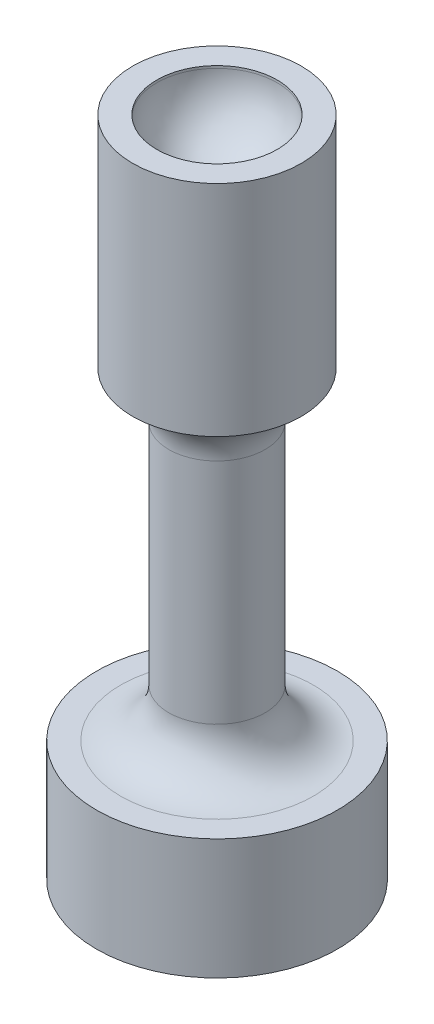
from build123d import *

# Parameters (mm, degrees)
SKETCH1_R           = 5
BOSS_EXTRUDE1_DEPTH = 27.5
SKETCH11_R          = 2.5
CUT_EXTRUDE3_DEPTH  = 0.1
DOME2_FACE_RADIUS   = 2.5
DOME2_HEIGHT        = 2.5
CUT_EXTRUDE4_START  = -22.5
SKETCH12_R          = 5
SKETCH12_R_2        = 3.5
CUT_EXTRUDE4_DEPTH  = 22.5
CUT_EXTRUDE5_DEPTH  = 3
SKETCH14_W          = 3
SKETCH14_H          = 13.4
FILLET2_R           = 2
FILLET3_R           = 2


with BuildPart() as part:
    # Sketch1 → Boss-Extrude1 (new body)
    with BuildSketch(Plane(origin=(0, 0, 0), x_dir=(1, 0, 0), z_dir=(0, 1, 0))):
        with Locations(Location((0, 0, 0), (0, 0, 270))):
            Circle(SKETCH1_R)
    extrude(amount=BOSS_EXTRUDE1_DEPTH)

    # Sketch11 → Cut-Extrude3 (cut)
    with BuildSketch(Plane(origin=(0, 27.5, 0), x_dir=(1, 0, 0), z_dir=(0, 1, 0))):
        with Locations(Location((0, 0, 0), (0, 0, 270))):
            Circle(SKETCH11_R)
    extrude(amount=-CUT_EXTRUDE3_DEPTH, mode=Mode.SUBTRACT)

    # Dome2: an elliptical dome of height H over a round flat face of radius A is half a spheroid: the quarter ellipse of half axes A and H revolved about the face's axis
    with BuildSketch(Plane((0, 27.4, 0), x_dir=(0, 0, 1), z_dir=(1, 0, 0)), mode=Mode.PRIVATE) as dome2_quarter:
        Ellipse(DOME2_FACE_RADIUS, DOME2_HEIGHT)
        Rectangle(DOME2_FACE_RADIUS, DOME2_HEIGHT, align=(Align.MIN, Align.MIN), mode=Mode.INTERSECT)
    revolve(dome2_quarter.sketch, axis=Axis((0, 27.4, 0), (0, -1, 0)), mode=Mode.SUBTRACT)

    # Sketch12 → Cut-Extrude4 (cut)
    with BuildSketch(Plane(origin=(0, 27.5, 0), x_dir=(1, 0, 0), z_dir=(0, 1, 0)).offset(CUT_EXTRUDE4_START)):
        with Locations(Location((0, 0, 0), (0, 0, 270))):
            Circle(SKETCH12_R)
        with Locations(Location((0, 0, 0), (0, 0, 270))):
            Circle(SKETCH12_R_2, mode=Mode.SUBTRACT)
    extrude(amount=CUT_EXTRUDE4_DEPTH, mode=Mode.SUBTRACT)

    # Sketch2 → Cut-Extrude5 (cut)
    with BuildSketch(Plane.XZ):
        Polygon((-2.054262095, 3.480422471), (-4.041265323, -0.038831925), (-1.987003228, -3.519254396), (2.054262095, -3.480422471), (4.041265323, 0.038831925), (1.987003228, 3.519254396), align=None)
    extrude(amount=-CUT_EXTRUDE5_DEPTH, mode=Mode.SUBTRACT)

    # Sketch14 → Cut-Revolve1 (revolve, cut)
    with BuildSketch(Plane.XY, mode=Mode.PRIVATE) as cut_revolve1_sk:
        with Locations((3.5, 11.7)):
            Rectangle(SKETCH14_W, SKETCH14_H)
    revolve(cut_revolve1_sk.sketch.rotate(Axis((0, 0, 0), (0, 1, 0)), 270), axis=Axis((0, 0, 0), (0, 1, 0)), mode=Mode.SUBTRACT)

    # Fillet2
    fillet2_edges = [part.edges().sort_by_distance(p)[0] for p in [
        (0, 5, -2),
    ]]
    fillet(fillet2_edges, radius=FILLET2_R)

    # Fillet3
    # the kernel refuses this fillet: 2 mm, written as the material it adds along each edge
    with BuildSketch(Plane(origin=(0, 18.4, 0), x_dir=(0, 0, 1), z_dir=(-1, 0, 0))) as fillet3_piece_1:
        with BuildLine():
            CenterArc((4, -1.936491673), FILLET3_R, 104.477512186, 75.522487814)
            Line((3.5, 0), (3.49, 0.038729833))
            ThreePointArc((3.49, 0.038729833), (2.75, 0.04), (2, 0.04))
            Line((2, 0.04), (1.96, 0))
            Line((1.96, 0), (1.96, -1.936491673))
            Line((1.96, -1.936491673), (2, -1.936491673))
        make_face()
    revolve(axis=Axis((0, 18.4, 0), (0, 1, 0)))


solid = part.part
